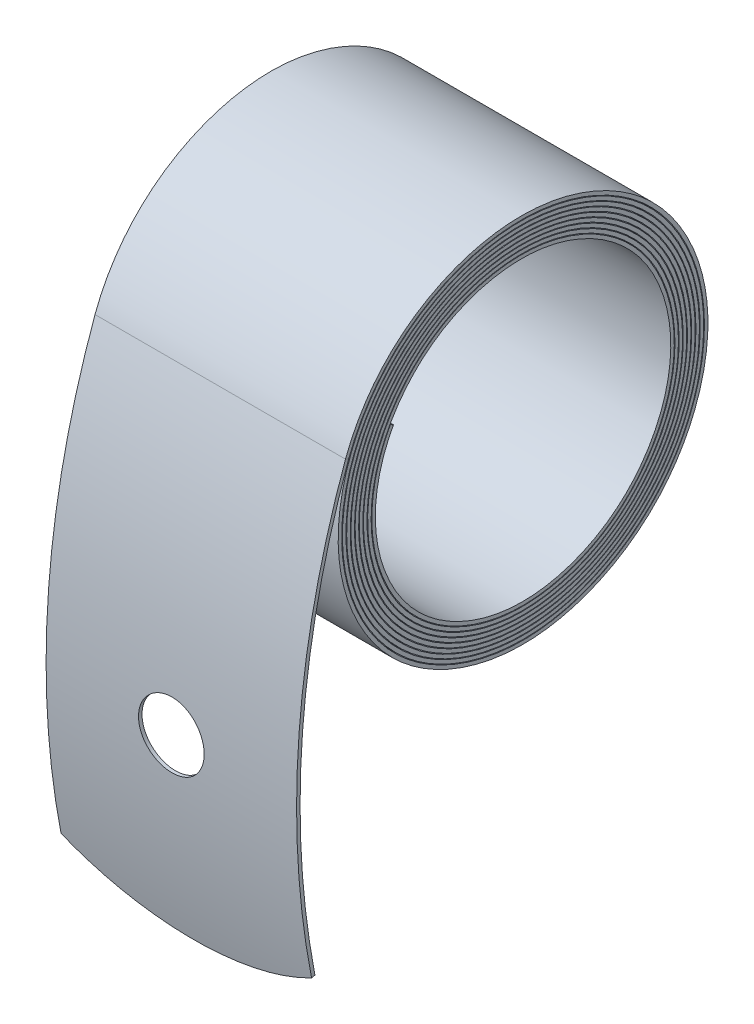
from build123d import *

# Parameters (mm, degrees)
SWEEP1_START            = -6.35
SWEEP1_DEPTH            = 12.7
CUT_EXTRUDE1_START      = -11.43
SKETCH7_R               = 1.6637
CUT_EXTRUDE1_DEPTH      = 0.211622
CUT_EXTRUDE2_REACH      = 31.856
CUT_EXTRUDE2_END_RADIUS = 40.935374197


# Read off the part's stored shape, not the designer's step: Sweep1
with BuildPart() as part:
    # Sweep1 outline → Sweep1 (new body)
    with BuildSketch(Plane.YZ.offset(SWEEP1_START)):
        with BuildLine():
            add(Edge.make_bspline(
                [(3.19663286, 8.783603258), (4.491356711, 8.307077565), (5.67796134, 7.539277756), (8.329047692, 4.833584743), (9.303565913, 2.438499942), (9.306919242, -2.370479854), (8.329747402, -4.75613623), (4.973257083, -8.182080374), (2.613765734, -9.202670679), (-2.167003377, -9.297265163), (-4.56022431, -8.377469201), (-8.032665973, -5.111768619), (-9.092107091, -2.785073432), (-9.289665804, 1.965393174), (-8.420721847, 4.361508772), (-5.243457293, 7.881330381), (-2.953943801, 8.984765511), (1.764661217, 9.27129743), (4.16578785, 8.459381125), (7.727620305, 5.373896382), (8.868041679, 3.11848507), (9.255029811, -1.565721124), (8.49351787, -3.967481469), (5.497480901, -7.572321483), (3.280729559, -8.754606955), (-1.368102343, -9.228156132), (-3.772361673, -8.523211778), (-7.414723906, -5.619731032), (-8.632090057, -3.438290684), (-9.20342664, 1.172200354), (-8.548340045, 3.574874196), (-5.735110591, 7.25586932), (-3.593696978, 8.512923313), (0.978050879, 9.168272068), (3.380757961, 8.569183982), (7.094794633, 5.849075045), (8.384987554, 3.744082902), (9.135302537, -0.785542549), (8.585429317, -3.184490974), (5.956168515, -6.93279324), (3.892457083, -8.260456941), (-0.595205345, -9.092106231), (-2.99177224, -8.597556454), (-6.76865312, -6.061770345), (-8.12748265, -4.035491615), (-9.051133266, 0.406433148), (-8.605062035, 2.797118373), (-6.16051622, 6.603914446), (-4.176658379, 7.997962448), (0.220237411, 9.000148428), (2.606181813, 8.608622817), (6.437120931, 6.257698189), (7.860335159, 4.312184364), (8.951422706, -0.035530134), (8.60754893, -2.413523976), (6.348054497, -6.270054154), (4.445987187, -7.726204875), (0.146209276, -8.89291586), (-2.224744248, -8.602710535), (-6.101018719, -6.436778974), (-7.584314411, -4.573866633), (-8.836701405, -0.326537107), (-8.593234013, 2.034454895), (-6.518723134, 5.932031758), (-4.700167905, 7.445957871), (-0.503520199, 8.770951642), (1.848195921, 8.580179785), (5.761164409, 6.59897195), (7.300197424, 4.820282063), (8.70752508, 0.679168853), (8.562493425, -1.660636344), (6.672500601, -5.590663032), (4.938963169, -7.158001864), (0.851111001, -8.634823292), (-1.477250622, -8.54142227), (-5.418371404, -6.744274858), (-7.008767075, -5.051212572), (-8.564473081, -1.021796039), (-8.515734212, 1.292770274), (-6.809403636, 5.246758341), (-5.162173941, 6.863122232), (-1.188428439, 8.485121168), (1.112598219, 8.486859975), (5.073446815, 6.872723482), (6.710810281, 5.266478404), (8.408146812, 1.353881176), (8.453393051, -0.931534069), (6.929486764, -4.901120885), (5.369639503, -6.562107488), (1.514951262, -8.322456879), (-0.754903389, -8.416943854), (-4.727189718, -6.984391123), (-6.407116175, -5.465938074), (-8.239168121, -1.674919187), (-8.375934923, 0.577579313), (-7.032841731, 4.554544978), (-5.561237374, 6.255747459), (-1.830191013, 8.147461652), (0.404804415, 8.332152484), (4.380389444, 7.079387994), (6.098474304, 5.649488244), (8.058177653, 1.984438171), (8.283851724, -0.231530616), (7.119596856, -4.207814353), (5.736883132, -5.944831489), (2.133692748, -7.960784681), (-0.06291205, -8.232990653), (-4.033823913, -7.157860537), (-5.785672836, -5.817063513), (-7.865833187, -2.282000082), (-8.177660845, -0.10601548), (-7.189916318, 3.861700512), (-5.896530168, 5.630146658), (-2.425035673, 7.763091438), (-0.270191545, 8.11998791), (3.688257994, 7.219990672), (5.469496786, 5.968636115), (7.662807932, 2.567201326), (8.057903689, 0.434491534), (7.24399936, -3.516961117), (6.040169347, -5.312476014), (2.703833709, -7.555061974), (0.593953794, -7.993697071), (-3.344441924, -7.265994962), (-5.150726265, -6.104215547), (-7.449788819, -2.839673282), (-7.925144166, -0.753360155), (-7.282079427, 3.174338418), (-6.167828587, 4.992596835), (-2.969735962, 7.337389196), (-0.907852618, 7.854692684), (3.003109758, 7.296123718), (4.830134756, 6.223848113), (7.22747477, 3.099082735), (7.779967134, 1.062114883), (7.304423234, -2.834557741), (6.279572373, -4.671278922), (3.22242712, -7.110777127), (1.211397282, -7.703569461), (-2.664977878, -7.310660032), (-4.508487417, -6.327616389), (-6.996574954, -3.345132228), (-7.622976816, -1.36028099), (-7.311329763, 2.498326015), (-6.375501175, 4.349282911), (-3.461627761, 6.875939165), (-1.504129153, 7.540940678), (1.508985117, 7.359423446), (2.589138086, 7.046639627), (3.548846787, 6.518436637)],
                knots=[5.98e-07, 5.98e-07, 5.98e-07, 5.98e-07, 0.0078125, 0.0078125, 0.021484375, 0.021484375, 0.03515625, 0.03515625, 0.048828125, 0.048828125, 0.0625, 0.0625, 0.076171875, 0.076171875, 0.08984375, 0.08984375, 0.103515625, 0.103515625, 0.1171875, 0.1171875, 0.130859375, 0.130859375, 0.14453125, 0.14453125, 0.158203125, 0.158203125, 0.171875, 0.171875, 0.185546875, 0.185546875, 0.19921875, 0.19921875, 0.212890625, 0.212890625, 0.2265625, 0.2265625, 0.240234375, 0.240234375, 0.25390625, 0.25390625, 0.267578125, 0.267578125, 0.28125, 0.28125, 0.294921875, 0.294921875, 0.30859375, 0.30859375, 0.322265625, 0.322265625, 0.3359375, 0.3359375, 0.349609375, 0.349609375, 0.36328125, 0.36328125, 0.376953125, 0.376953125, 0.390625, 0.390625, 0.404296875, 0.404296875, 0.41796875, 0.41796875, 0.431640625, 0.431640625, 0.4453125, 0.4453125, 0.458984375, 0.458984375, 0.47265625, 0.47265625, 0.486328125, 0.486328125, 0.5, 0.5, 0.513671875, 0.513671875, 0.52734375, 0.52734375, 0.541015625, 0.541015625, 0.5546875, 0.5546875, 0.568359375, 0.568359375, 0.58203125, 0.58203125, 0.595703125, 0.595703125, 0.609375, 0.609375, 0.623046875, 0.623046875, 0.63671875, 0.63671875, 0.650390625, 0.650390625, 0.6640625, 0.6640625, 0.677734375, 0.677734375, 0.69140625, 0.69140625, 0.705078125, 0.705078125, 0.71875, 0.71875, 0.732421875, 0.732421875, 0.74609375, 0.74609375, 0.759765625, 0.759765625, 0.7734375, 0.7734375, 0.787109375, 0.787109375, 0.80078125, 0.80078125, 0.814453125, 0.814453125, 0.828125, 0.828125, 0.841796875, 0.841796875, 0.85546875, 0.85546875, 0.869140625, 0.869140625, 0.8828125, 0.8828125, 0.896484375, 0.896484375, 0.91015625, 0.91015625, 0.923828125, 0.923828125, 0.9375, 0.9375, 0.951171875, 0.951171875, 0.96484375, 0.96484375, 0.978515625, 0.978515625, 0.9921875, 0.9921875, 1, 1, 1, 1], degree=3))
            Line((3.548846787, 6.518436637), (3.634577196, 6.674202927))
            add(Edge.make_bspline(
                [(3.257741865, 8.950572213), (4.577594434, 8.464849532), (5.786218407, 7.682840894), (8.488714796, 4.924678846), (9.481333898, 2.484474896), (9.484751171, -2.416206847), (8.488642042, -4.848015692), (5.068371177, -8.339060154), (2.66312586, -9.379528819), (-2.209328816, -9.475937434), (-4.648029713, -8.538968215), (-8.188478144, -5.209309829), (-9.267848369, -2.83827265), (-9.46921742, 2.003816746), (-8.583237514, 4.446819976), (-5.344905278, 8.034293285), (-3.010488122, 9.159459428), (1.799651835, 9.451549703), (4.246922076, 8.624332507), (7.879317461, 5.477721688), (9.041462853, 3.178819561), (9.436001271, -1.596777283), (8.659383125, -4.046082116), (5.605093244, -7.721012197), (3.3443635, -8.926845012), (-1.395699883, -9.409687403), (-3.846689406, -8.691340033), (-7.562052855, -5.729666935), (-8.802901625, -3.505659546), (-9.385515752, 1.195837417), (-8.717277875, 3.646633208), (-5.848707476, 7.400039684), (-3.664314129, 8.682417992), (0.998209438, 9.350779221), (3.448155263, 8.740208326), (7.237509499, 5.96493785), (8.552904393, 3.818373489), (9.318205262, -0.801721229), (8.757157594, -3.249288707), (6.07556014, -7.072202663), (3.969939376, -8.42692533), (-0.607891448, -9.27528454), (-3.05212676, -8.771191288), (-6.906515753, -6.183366472), (-8.292224494, -4.116579729), (-9.234544227, 0.415126619), (-8.779293993, 2.854846822), (-6.28550312, 6.738330308), (-4.260876288, 8.161126708), (0.225430068, 9.18369207), (2.659392971, 8.784578201), (6.569901301, 6.384824497), (8.021627065, 4.39993446), (9.135035703, -0.036724075), (8.78399364, -2.46408695), (6.478427874, -6.39925219), (4.536799946, -7.88579271), (0.148518537, -9.076518424), (-2.270723403, -8.780692677), (-6.228495303, -6.569223098), (-7.741887221, -4.668132051), (-9.020209923, -0.332844489), (-8.771596876, 2.077768181), (-6.654265214, 6.055796439), (-4.797423743, 7.601702977), (-0.513327322, 8.954306643), (1.886866518, 8.75989153), (5.883124561, 6.736512663), (7.453788212, 4.920905271), (8.890622804, 0.692966823), (8.742476661, -1.696627842), (6.812984991, -5.708787921), (5.042499567, -7.309644378), (0.868399404, -8.817624685), (-1.508548319, -8.722563601), (-5.534611711, -6.886682438), (-7.158119589, -5.158025437), (-8.746854407, -1.043061352), (-8.69703736, 1.32138012), (-6.95459571, 5.359046436), (-5.271817905, 7.010409168), (-1.21316905, 8.667063858), (1.136470993, 8.669128511), (5.183773431, 7.019760099), (6.855675369, 5.379302465), (8.589507359, 1.382578119), (8.635713472, -0.952714733), (7.079144055, -5.007384952), (5.485207854, -6.704793152), (1.547102564, -8.503237232), (-0.771311624, -8.60003536), (-4.831418692, -7.135811237), (-6.547252203, -5.58458485), (-8.419205242, -1.710999637), (-8.558968306, 0.591295675), (-7.186714335, 4.654607858), (-5.682537054, 6.393593867), (-1.869699116, 8.326778005), (0.413720962, 8.515761379), (4.478347027, 7.234938767), (6.233647556, 5.773759549), (8.236590939, 2.027841681), (8.467292598, -0.237760025), (7.277427854, -4.301509262), (5.863711533, -6.07760876), (2.180491483, -8.138337843), (-0.064322275, -8.41681052), (-4.125346844, -7.31728226), (-5.915657909, -5.946751783), (-8.042324969, -2.33265398), (-8.361203087, -0.10728317), (-7.351442207, 3.948871316), (-6.028675468, 5.757633399), (-2.479046702, 7.938585193), (-0.27628974, 8.303712012), (3.773193776, 7.383017194), (5.594076962, 6.103524764), (7.837083781, 2.62502084), (8.241241039, 0.443253947), (7.408950493, -3.597462591), (6.177410865, -5.43445969), (2.764966659, -7.728203577), (0.607549968, -8.177018862), (-3.422649072, -7.432354143), (-5.269693875, -6.244079328), (-7.621558039, -2.904561684), (-8.107970737, -0.769602401), (-7.450180467, 3.248036492), (-6.309937161, 5.108874124), (-3.037888576, 7.507889858), (-0.928923811, 8.037306323), (3.074458042, 7.465537882), (4.943291525, 6.368453496), (7.396450879, 3.170931503), (7.961977927, 1.085809584), (7.475393613, -2.901329718), (6.426310734, -4.781656052), (3.297485431, -7.278352505), (1.239908056, -7.885170324), (-2.729348534, -7.482846433), (-4.615644796, -6.476721952), (-7.162476169, -3.423821231), (-7.803868229, -1.391388327), (-7.484884157, 2.558060779), (-6.526624354, 4.453575983), (-3.543466286, 7.040309831), (-1.54003165, 7.721225869), (1.546302097, 7.535297721), (2.651517558, 7.21525777), (3.634577196, 6.674202927)],
                knots=[0, 0, 0, 0, 0.0078125, 0.0078125, 0.021484375, 0.021484375, 0.03515625, 0.03515625, 0.048828125, 0.048828125, 0.0625, 0.0625, 0.076171875, 0.076171875, 0.08984375, 0.08984375, 0.103515625, 0.103515625, 0.1171875, 0.1171875, 0.130859375, 0.130859375, 0.14453125, 0.14453125, 0.158203125, 0.158203125, 0.171875, 0.171875, 0.185546875, 0.185546875, 0.19921875, 0.19921875, 0.212890625, 0.212890625, 0.2265625, 0.2265625, 0.240234375, 0.240234375, 0.25390625, 0.25390625, 0.267578125, 0.267578125, 0.28125, 0.28125, 0.294921875, 0.294921875, 0.30859375, 0.30859375, 0.322265625, 0.322265625, 0.3359375, 0.3359375, 0.349609375, 0.349609375, 0.36328125, 0.36328125, 0.376953125, 0.376953125, 0.390625, 0.390625, 0.404296875, 0.404296875, 0.41796875, 0.41796875, 0.431640625, 0.431640625, 0.4453125, 0.4453125, 0.458984375, 0.458984375, 0.47265625, 0.47265625, 0.486328125, 0.486328125, 0.5, 0.5, 0.513671875, 0.513671875, 0.52734375, 0.52734375, 0.541015625, 0.541015625, 0.5546875, 0.5546875, 0.568359375, 0.568359375, 0.58203125, 0.58203125, 0.595703125, 0.595703125, 0.609375, 0.609375, 0.623046875, 0.623046875, 0.63671875, 0.63671875, 0.650390625, 0.650390625, 0.6640625, 0.6640625, 0.677734375, 0.677734375, 0.69140625, 0.69140625, 0.705078125, 0.705078125, 0.71875, 0.71875, 0.732421875, 0.732421875, 0.74609375, 0.74609375, 0.759765625, 0.759765625, 0.7734375, 0.7734375, 0.787109375, 0.787109375, 0.80078125, 0.80078125, 0.814453125, 0.814453125, 0.828125, 0.828125, 0.841796875, 0.841796875, 0.85546875, 0.85546875, 0.869140625, 0.869140625, 0.8828125, 0.8828125, 0.896484375, 0.896484375, 0.91015625, 0.91015625, 0.923828125, 0.923828125, 0.9375, 0.9375, 0.951171875, 0.951171875, 0.96484375, 0.96484375, 0.978515625, 0.978515625, 0.9921875, 0.9921875, 1, 1, 1, 1], degree=3))
            ThreePointArc((3.257741865, 8.950572213), (-8.435668048, 11.361741227), (-20.328791866, 10.311418782))
            Line((-20.328791866, 10.311418782), (-20.287599596, 10.138456252))
            ThreePointArc((-20.287599596, 10.138456252), (-8.446067554, 11.184245549), (3.19663286, 8.783603258))
        make_face()
    extrude(amount=SWEEP1_DEPTH)

    # Sketch7 → Cut-Extrude1 (cut)
    with BuildSketch(Plane(origin=(0, -4.268002453, 0), x_dir=(1, 0, 0), z_dir=(0, 0, -1)).offset(CUT_EXTRUDE1_START)):
        with Locations((0, 6.535789414)):
            Circle(SKETCH7_R)
    extrude(amount=CUT_EXTRUDE1_DEPTH, mode=Mode.SUBTRACT)

    # Cut-Extrude2: up to this cylinder (the profile starts outside it)
    cut_extrude2_end = Plane(origin=(6.221503, -10.803791866, -29.683174197), z_dir=(-1, 0, 0)) * Cylinder(CUT_EXTRUDE2_END_RADIUS, 146.582748395, mode=Mode.PRIVATE)
    # Sketch8 → Cut-Extrude2 (cut, up to the surface)
    with BuildSketch(Plane(origin=(0, -3.415065631, 14.339544346), x_dir=(1, 0, 0), z_dir=(0, -0.2316775628726684, 0.9727926330217457)), mode=Mode.PRIVATE) as cut_extrude2_sk1:
        with BuildLine():
            Line((6.35, -17.386774593), (6.35, -15.685297221))
            ThreePointArc((6.35, -15.685297221), (0, -17.386774593), (-6.35, -15.685297221))
            Line((-6.35, -15.685297221), (-6.35, -17.386774593))
            Line((-6.35, -17.386774593), (-6.35, -17.640774593))
            Line((-6.35, -17.640774593), (6.35, -17.640774593))
            Line((6.35, -17.640774593), (6.35, -17.386774593))
        make_face()
    cut_extrude2_tool1 = extrude(cut_extrude2_sk1.sketch, amount=-CUT_EXTRUDE2_REACH, mode=Mode.PRIVATE) - cut_extrude2_end
    add(cut_extrude2_tool1.solids().sort_by_distance((6.221503, -19.5012, 10.508516))[0], mode=Mode.SUBTRACT)


solid = part.part
